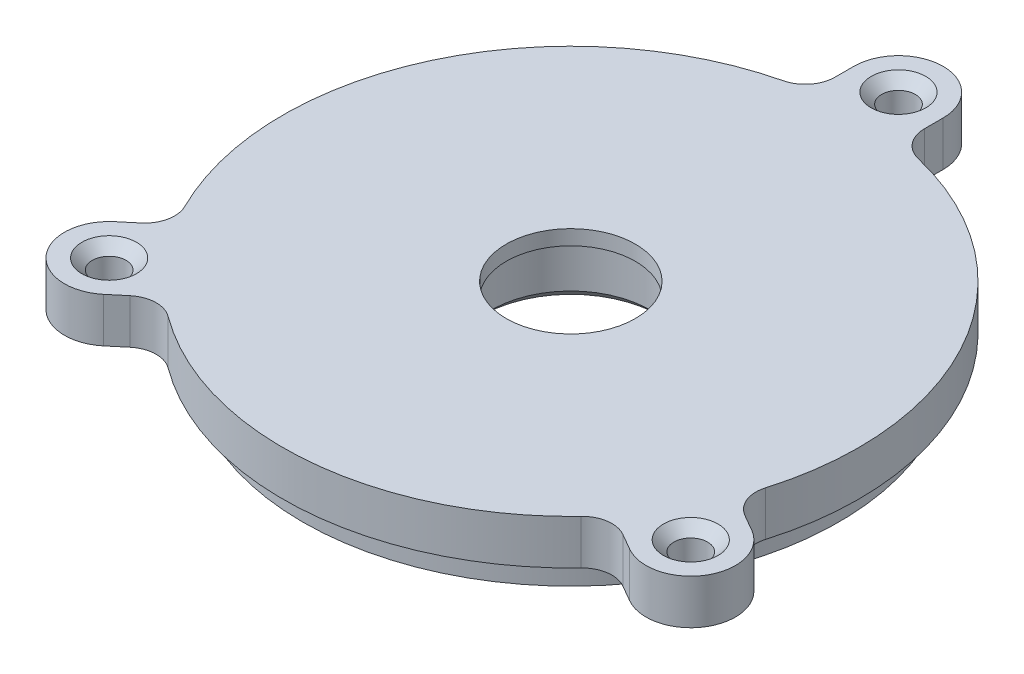
from build123d import *

# Parameters (mm, degrees)
ESQUISSE1_R                      = 1.7
BOSS_EXTRU_1_DEPTH               = 4.5
CONG_1_R                         = 3
R_P_TITION_START                 = 3
R_P_TITION_CIRCULAIRE1_OUTLINE_R = 1.7
R_P_TITION_CIRCULAIRE1_DEPTH     = 4.5
CHANFREIN1_SIZE                  = 1.05


# Read off the part's stored shape, not the designer's step: Répétition circulaire1
with BuildPart() as part:
    # Sketch1 → Revolve1 (revolve)
    with BuildSketch(Plane.XY, mode=Mode.PRIVATE) as revolve1_sk:
        Polygon((9, 0), (27, 0), (27, 3), (29, 3), (29, 7.5), (6.5, 7.5), (6.5, 6), (8, 6), (8, 1), align=None)
    revolve(revolve1_sk.sketch.rotate(Axis((0, 16.318563478, 0), (0, -1, 0)), 90), axis=Axis((0, 16.318563478, 0), (0, -1, 0)))

    # Esquisse1 → Boss.-Extru.1 (add)
    with BuildSketch(Plane(origin=(0, 7.5, 0), x_dir=(1, 0, 0), z_dir=(0, 1, 0))):
        with BuildLine():
            Line((-4.5, 33), (-4.5, 28.648734702))
            ThreePointArc((-4.5, 28.648734702), (0, 29), (4.5, 28.648734702))
            Line((4.5, 28.648734702), (4.5, 33))
            ThreePointArc((4.5, 33), (0, 37.5), (-4.5, 33))
        make_face()
        with Locations(Location((0, 33, 0), (0, 0, 270))):
            Circle(ESQUISSE1_R, mode=Mode.SUBTRACT)
    extrude(amount=-BOSS_EXTRU_1_DEPTH)

    # Congé1
    cong_1_edges = [part.edges().sort_by_distance(p)[0] for p in [
        (-4.5, 5.25, -28.648734702),
        (4.5, 5.25, -28.648734702),
    ]]
    fillet(cong_1_edges, radius=CONG_1_R)

    # Répétition circulaire1 outline → Répétition circulaire1 (add)
    # profile 1 of 2: a face of its own
    with BuildSketch(Plane(origin=(0, 0, 0), x_dir=(1, 0, 0), z_dir=(0, 1, 0)).offset(R_P_TITION_START)):
        with BuildLine():
            ThreePointArc((26.328838325, -20.397114317), (32.475952642, -18.75), (30.828838325, -12.602885683))
            Line((30.828838325, -12.602885683), (29.190907557, -11.657225913))
            ThreePointArc((29.190907557, -11.657225913), (27.905010686, -10.172154026), (27.813634974, -8.209854417))
            ThreePointArc((27.813634974, -8.209854417), (25.11473671, -14.5), (21.016759974, -19.98238725))
            ThreePointArc((21.016759974, -19.98238725), (22.761849141, -19.080371134), (24.690907557, -19.451454547))
            Line((24.690907557, -19.451454547), (26.328838325, -20.397114317))
        make_face()
        with Locations((28.578838325, -16.5)):
            Circle(R_P_TITION_CIRCULAIRE1_OUTLINE_R, mode=Mode.SUBTRACT)
    # profile 2 of 2: a face of its own
    with BuildSketch(Plane(origin=(0, 0, 0), x_dir=(1, 0, 0), z_dir=(0, 1, 0)).offset(R_P_TITION_START)):
        with BuildLine():
            ThreePointArc((-20.938087556, -23.443474348), (-19.10277383, -22.743051047), (-17.227563034, -23.328331957))
            ThreePointArc((-17.227563034, -23.328331957), (-22.21528885, -18.640840681), (-25.965457103, -12.914915309))
            ThreePointArc((-25.965457103, -12.914915309), (-25.714694862, -14.863270403), (-26.723176043, -16.54907436))
            Line((-26.723176043, -16.54907436), (-28.172010867, -17.764791126))
            ThreePointArc((-28.172010867, -17.764791126), (-28.726666617, -24.104535364), (-22.386922379, -24.659191114))
            Line((-22.386922379, -24.659191114), (-20.938087556, -23.443474348))
        make_face()
        with Locations((-25.279466623, -21.21199112)):
            Circle(R_P_TITION_CIRCULAIRE1_OUTLINE_R, mode=Mode.SUBTRACT)
    extrude(amount=R_P_TITION_CIRCULAIRE1_DEPTH)

    # Chanfrein1
    chanfrein1_edges = [part.edges().sort_by_distance(p)[0] for p in [
        (0, 7.5, -34.7),
        (26.878838325, 7.5, 16.5),
        (-26.979466623, 7.5, 21.21199112),
    ]]
    chamfer(chanfrein1_edges, length=CHANFREIN1_SIZE)


solid = part.part
